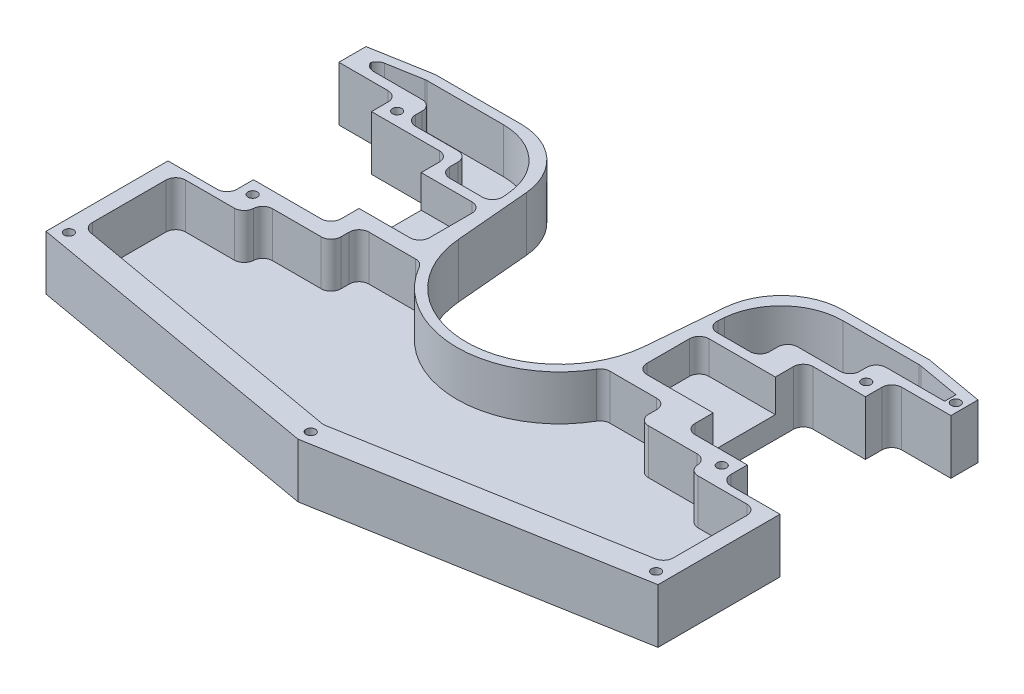
from build123d import *

# Parameters (mm, degrees)
SALIENTE_EXTRUIR1_DEPTH = 3
SALIENTE_EXTRUIR2_DEPTH = 17.5
REDONDEO1_R             = 3.175
REDONDEO3_R             = 3.175
REDONDEO5_R             = 3.175
CROQUIS5_R              = 1.5
CORTAR_EXTRUIR1_DEPTH   = 10
SALIENTE_EXTRUIR3_DEPTH = 7
REDONDEO6_R             = 3.175
REDONDEO7_R             = 3.175
REDONDEO8_R             = 3.175
REDONDEO12_R            = 20
REDONDEO11_R            = 20


with BuildPart() as part:
    # Croquis2 → Saliente-Extruir1 (new body)
    with BuildSketch(Plane(origin=(0, 0, 0), x_dir=(1, 0, 0), z_dir=(0, 1, 0))):
        with BuildLine():
            Line((-98.5, -27.5), (-98.5, -66.771770067))
            Line((-98.5, -66.771770067), (0, -84.139977667))
            Line((0, -84.139977667), (98.5, -66.771770067))
            Line((98.5, -66.771770067), (98.5, -27.5))
            Line((98.5, -27.5), (79.5, -27.5))
            Line((79.5, -27.5), (79.5, -19))
            Line((79.5, -19), (59.5, -19))
            Line((59.5, -19), (59.5, 19))
            Line((59.5, 19), (79.5, 19))
            Line((79.5, 19), (79.5, 27.5))
            Line((79.5, 27.5), (98.5, 27.5))
            Line((98.5, 27.5), (98.5, 36.239787367))
            Line((98.5, 36.239787367), (79.5, 39.59))
            Line((79.5, 39.59), (33.578271315, 39.59))
            Line((33.578271315, 39.59), (29.885840943, -2.614672282))
            ThreePointArc((29.885840943, -2.614672282), (0, -30), (-29.885840943, -2.614672282))
            Line((-29.885840943, -2.614672282), (-33.578271315, 39.59))
            Line((-33.578271315, 39.59), (-79.5, 39.59))
            Line((-79.5, 39.59), (-98.5, 36.239787367))
            Line((-98.5, 36.239787367), (-98.5, 27.5))
            Line((-98.5, 27.5), (-79.5, 27.5))
            Line((-79.5, 27.5), (-79.5, 19))
            Line((-79.5, 19), (-54.5, 19))
            Line((-54.5, 19), (-54.5, -19))
            Line((-54.5, -19), (-79.5, -19))
            Line((-79.5, -19), (-79.5, -27.5))
            Line((-79.5, -27.5), (-98.5, -27.5))
        make_face()
    extrude(amount=SALIENTE_EXTRUIR1_DEPTH)

    # Croquis2<3> → Saliente-Extruir2 (add)
    with BuildSketch(Plane(origin=(0, 0, 0), x_dir=(1, 0, 0), z_dir=(0, 1, 0))):
        with BuildLine():
            Line((-98.5, -27.5), (-98.5, -66.771770067))
            Line((-98.5, -66.771770067), (0, -84.139977667))
            Line((0, -84.139977667), (98.5, -66.771770067))
            Line((98.5, -66.771770067), (98.5, -27.5))
            Line((98.5, -27.5), (79.5, -27.5))
            Line((79.5, -27.5), (79.5, -19))
            Line((79.5, -19), (59.5, -19))
            Line((59.5, -19), (59.5, -10))
            Line((59.5, -10), (35, -10))
            Line((35, -10), (35, 10))
            Line((35, 10), (59.5, 10))
            Line((59.5, 10), (59.5, 19))
            Line((59.5, 19), (79.5, 19))
            Line((79.5, 19), (79.5, 27.5))
            Line((79.5, 27.5), (98.5, 27.5))
            Line((98.5, 27.5), (98.5, 36.239787367))
            Line((98.5, 36.239787367), (79.5, 39.59))
            Line((79.5, 39.59), (33.578271315, 39.59))
            Line((33.578271315, 39.59), (29.885840943, -2.614672282))
            ThreePointArc((29.885840943, -2.614672282), (0, -30), (-29.885840943, -2.614672282))
            Line((-29.885840943, -2.614672282), (-33.578271315, 39.59))
            Line((-33.578271315, 39.59), (-79.5, 39.59))
            Line((-79.5, 39.59), (-98.5, 36.239787367))
            Line((-98.5, 36.239787367), (-98.5, 27.5))
            Line((-98.5, 27.5), (-79.5, 27.5))
            Line((-79.5, 27.5), (-79.5, 19))
            Line((-79.5, 19), (-54.5, 19))
            Line((-54.5, 19), (-54.5, 10))
            Line((-54.5, 10), (-35, 10))
            Line((-35, 10), (-35, -10))
            Line((-35, -10), (-54.5, -10))
            Line((-54.5, -10), (-54.5, -19))
            Line((-54.5, -19), (-79.5, -19))
            Line((-79.5, -19), (-79.5, -27.5))
            Line((-79.5, -27.5), (-98.5, -27.5))
        make_face()
        Polygon((-36.327264837, 36.59), (-34.263407265, 13), (-51.5, 13), (-51.5, 22), (-71.5, 22), (-71.5, 30.5), (-93.5, 30.5), (-93.5, 34.12142227), (-79.5, 36.59), align=None, mode=Mode.SUBTRACT)
        with BuildLine():
            Line((0, -76.016564772), (-93.5, -59.529992076))
            Line((-93.5, -59.529992076), (-93.5, -30))
            Line((-93.5, -30), (-71.5, -30))
            Line((-71.5, -30), (-71.5, -24))
            Line((-71.5, -24), (-49.5, -24))
            Line((-49.5, -24), (-49.5, -15))
            Line((-49.5, -15), (-29.393876913, -15))
            ThreePointArc((-29.393876913, -15), (0, -33), (29.393876913, -15))
            Line((29.393876913, -15), (49.5, -15))
            Line((49.5, -15), (49.5, -24))
            Line((49.5, -24), (71.5, -24))
            Line((71.5, -24), (71.5, -30))
            Line((71.5, -30), (93.5, -30))
            Line((93.5, -30), (93.5, -59.529992076))
            Line((93.5, -59.529992076), (0, -76.016564772))
        make_face(mode=Mode.SUBTRACT)
        Polygon((71.5, 30.5), (71.5, 22), (51.5, 22), (51.5, 13), (34.263407265, 13), (36.327264837, 36.59), (79.5, 36.59), (93.5, 34.12142227), (93.5, 30.5), align=None, mode=Mode.SUBTRACT)
    extrude(amount=SALIENTE_EXTRUIR2_DEPTH)

    # Redondeo1
    # the kernel refuses this fillet: 3.175 mm, written as the material it adds along each edge
    with BuildSketch(Plane(origin=(-79.5, 2.305558733, -36.59), x_dir=(1, 0, 0), z_dir=(0, 1, 0))) as redondeo1_piece_1:
        with BuildLine():
            CenterArc((REDONDEO1_R * 0.0874886635259, -REDONDEO1_R), REDONDEO1_R, 90, 10)
            Line((-REDONDEO1_R * 0.086159514141, -REDONDEO1_R * 0.0151922469878), (0, 0))
            Line((0, 0), (REDONDEO1_R * 0.0874886635259, 0))
        make_face()
    extrude(amount=15.194441267)
    with BuildSketch(Plane(origin=(-51.5, 3, -13), x_dir=(0, 0, -1), z_dir=(0, 1, 0)), Plane(origin=(-71.5, 3, -22), x_dir=(0, 0, -1), z_dir=(0, 1, 0)), Plane(origin=(-93.5, 3, -30.5), x_dir=(0, 0, -1), z_dir=(0, 1, 0))) as redondeo1_piece_2:
        with BuildLine():
            CenterArc((REDONDEO1_R, -REDONDEO1_R), REDONDEO1_R, 90, 90)
            Line((0, -REDONDEO1_R), (0, 0))
            Line((0, 0), (REDONDEO1_R, 0))
        make_face()
    extrude(amount=14.5)
    with BuildSketch(Plane(origin=(-93.5, 3, -34.12142227), x_dir=(0.9848077530122092, 0, -0.17364817766692342), z_dir=(0, 1, 0))) as redondeo1_piece_3:
        with BuildLine():
            CenterArc((REDONDEO1_R * 0.839099631177, -REDONDEO1_R), REDONDEO1_R, 90, 80)
            Line((-REDONDEO1_R * 0.145708121835, -REDONDEO1_R * 0.826351822333), (0, 0))
            Line((0, 0), (REDONDEO1_R * 0.839099631177, 0))
        make_face()
    extrude(amount=14.5)

    # Redondeo3
    redondeo3_edges = [part.edges().sort_by_distance(p)[0] for p in [
        (-49.5, 10.25, 15),
        (-29.393876913, 10.25, 15),
        (29.393876913, 10.25, 15),
        (49.5, 10.25, 15),
        (71.5, 10.25, 24),
        (93.5, 10.25, 30),
        (93.5, 10.25, 59.529992076),
        (0, 10.25, 76.016564772),
        (-93.5, 10.25, 59.529992076),
        (-93.5, 10.25, 30),
        (-71.5, 10.25, 24),
    ]]
    fillet(redondeo3_edges, radius=REDONDEO3_R)

    # Redondeo5
    redondeo5_edges = [part.edges().sort_by_distance(p)[0] for p in [
        (-49.5, 10.25, 24),
        (-71.5, 10.25, 30),
        (71.5, 10.25, 30),
        (49.5, 10.25, 24),
        (71.5, 10.25, -30.5),
        (51.5, 10.25, -22),
        (-51.5, 10.25, -22),
        (-71.5, 10.25, -30.5),
    ]]
    fillet(redondeo5_edges, radius=REDONDEO5_R)

    # Croquis5 → Cortar-Extruir1 (cut)
    with BuildSketch(Plane(origin=(0, 17.5, 0), x_dir=(1, 0, 0), z_dir=(0, 1, 0))):
        with Locations(Location((0, -80.053781473, 0), (0, 0, 270))):
            Circle(CROQUIS5_R)
        with Locations(Location((-94.5, -63.390881796, 0), (0, 0, 270))):
            Circle(CROQUIS5_R)
        with Locations(Location((-75.5, -23.25, 0), (0, 0, 270))):
            Circle(CROQUIS5_R)
        with Locations(Location((-75.5, 23.25, 0), (0, 0, 90))):
            Circle(CROQUIS5_R)
        with Locations(Location((75.5, 23.25, 0), (0, 0, 270))):
            Circle(CROQUIS5_R)
        with Locations(Location((95.718468624, 31.869893683, 0), (0, 0, 90))):
            Circle(CROQUIS5_R)
        with Locations(Location((75.5, -23.25, 0), (0, 0, 90))):
            Circle(CROQUIS5_R)
        with Locations(Location((94.5, -63.390881796, 0), (0, 0, 90))):
            Circle(CROQUIS5_R)
    extrude(amount=-CORTAR_EXTRUIR1_DEPTH, mode=Mode.SUBTRACT)

    # Croquis2<4> → Saliente-Extruir3 (add)
    with BuildSketch(Plane(origin=(0, 0, 0), x_dir=(1, 0, 0), z_dir=(0, 1, 0))):
        Polygon((-54.5, 10), (-54.5, -10), (-37.5, -10), (-35, -10), (-35, 10), (-37.5, 10), align=None)
        Polygon((37.5, -10), (59.5, -10), (59.5, 10), (37.5, 10), (35, 10), (35, -10), align=None)
    extrude(amount=SALIENTE_EXTRUIR3_DEPTH)

    # Redondeo6
    redondeo6_edges = [part.edges().sort_by_distance(p)[0] for p in [
        (-35, 12.25, -10),
        (-35, 12.25, 10),
        (35, 12.25, 10),
        (35, 12.25, -10),
        (79.5, 8.75, -27.5),
        (59.5, 8.75, -19),
        (59.5, 8.75, 19),
        (79.5, 8.75, 27.5),
        (-79.5, 8.75, 27.5),
        (-54.5, 8.75, 19),
        (-54.5, 8.75, -19),
        (-79.5, 8.75, -27.5),
    ]]
    fillet(redondeo6_edges, radius=REDONDEO6_R)

    # Redondeo7
    redondeo7_edges = [part.edges().sort_by_distance(p)[0] for p in [
        (-34.263407265, 10.25, -13),
    ]]
    fillet(redondeo7_edges, radius=REDONDEO7_R)

    # Redondeo8
    redondeo8_edges = [part.edges().sort_by_distance(p)[0] for p in [
        (34.263407265, 10.25, -13),
        (79.5, 10.25, -36.59),
        (71.5, 10.25, -22),
        (51.5, 10.25, -13),
    ]]
    fillet(redondeo8_edges, radius=REDONDEO8_R)

    # Redondeo12
    redondeo12_edges = [part.edges().sort_by_distance(p)[0] for p in [
        (36.327264837, 10.25, -36.59),
        (-36.327264837, 10.25, -36.59),
    ]]
    fillet(redondeo12_edges, radius=REDONDEO12_R)

    # Redondeo11
    redondeo11_edges = [part.edges().sort_by_distance(p)[0] for p in [
        (-33.578271315, 8.75, -39.59),
        (33.578271315, 8.75, -39.59),
    ]]
    fillet(redondeo11_edges, radius=REDONDEO11_R)


solid = part.part
